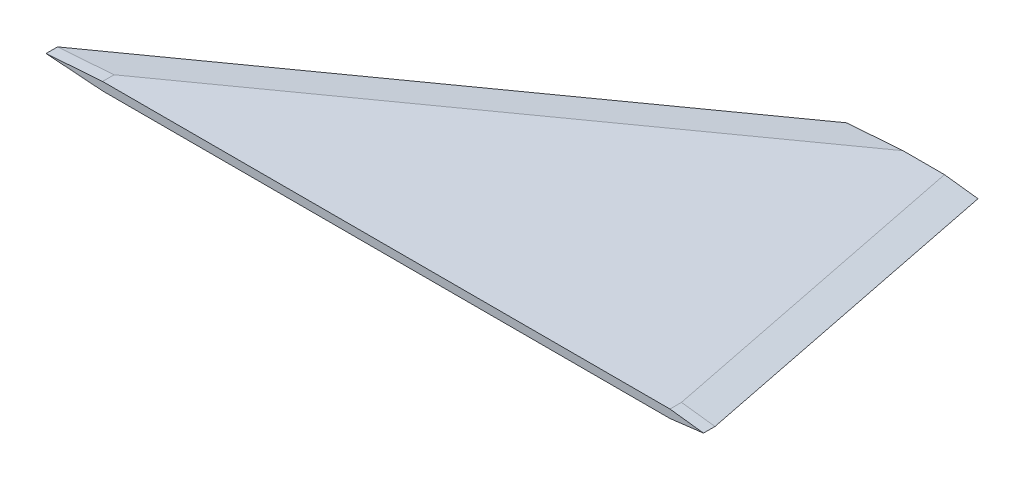
from build123d import *
from OCP.BRepFilletAPI import BRepFilletAPI_MakeChamfer

# Parameters (mm, degrees)
BOSS_EXTRUDE1_DEPTH = 1.5875
CHAMFER1_SIZE       = 1.5875
CHAMFER1_SIZE_2     = 12.7
CHAMFER2_SIZE       = 12.7
CHAMFER2_SIZE_2     = 1.5875
BOSS_EXTRUDE3_DEPTH = 4.445


# Some blends are built 0.0001 mm under size
with BuildPart() as part:
    # Sketch1 → Boss-Extrude1 (new, symmetric)
    with BuildSketch(Plane(origin=(0, 0, 0), x_dir=(1, 0, 0), z_dir=(0, 1, 0))):
        Polygon((-127, 0), (127, 0), (101.6, 127), (50.8, 127), align=None)
    extrude(amount=BOSS_EXTRUDE1_DEPTH, both=True)

    # Chamfer1
    # the kernel refuses this chamfer: 12.7, 1.5875 mm, written as the material it takes off along each edge
    with BuildSketch(Plane(origin=(77.661804698, 1.5875, -146.187003355), x_dir=(-0.1697730315694904, -0.9563912737708591, -0.2376822441972865), z_dir=(-0.8137334712067349, 0, 0.5812381937190965))) as chamfer1_piece_1:
        Polygon((CHAMFER1_SIZE * 0.956391273771, CHAMFER1_SIZE * 0.292088567827), (-CHAMFER1_SIZE_2 * 0.292088567827, CHAMFER1_SIZE_2 * 0.956391273771), (0, 0), align=None)
    extrude(amount=284.520199288, mode=Mode.SUBTRACT)
    with BuildSketch(Plane(origin=(77.661804698, -1.5875, -146.187003355), x_dir=(-0.1697730315694904, 0.9563912737708591, -0.2376822441972865), z_dir=(-0.8137334712067349, 0, 0.5812381937190965))) as chamfer1_piece_2:
        Polygon((CHAMFER1_SIZE * 0.956391273771, -CHAMFER1_SIZE * 0.292088567827), (-CHAMFER1_SIZE_2 * 0.292088567827, -CHAMFER1_SIZE_2 * 0.956391273771), (0, 0), align=None)
    extrude(amount=284.520199288, mode=Mode.SUBTRACT)

    # Chamfer2
    chamfer2_edges_1 = [part.edges().sort_by_distance(p)[0] for p in [
        (114.3, 1.5875, -63.5),
    ]]
    chamfer2_side_1 = [part.faces().sort_by_distance(p)[0] for p in [
        (114.268866564, 1.5875, -63.493773313),
    ]]
    chamfer2_edges_2 = [part.edges().sort_by_distance(p)[0] for p in [
        (114.3, -1.5875, -63.5),
    ]]
    chamfer2_side_2 = [part.faces().sort_by_distance(p)[0] for p in [
        (114.3, -1.55575, -63.5),
    ]]
    chamfer2 = BRepFilletAPI_MakeChamfer(part.part.solid().wrapped)
    for e in chamfer2_edges_1:
        chamfer2.Add(CHAMFER2_SIZE - 0.0001, CHAMFER2_SIZE_2 - 0.0001, e.wrapped, chamfer2_side_1[0].wrapped)
    for e in chamfer2_edges_2:
        chamfer2.Add(CHAMFER2_SIZE_2 - 0.0001, CHAMFER2_SIZE - 0.0001, e.wrapped, chamfer2_side_2[0].wrapped)
    add(Compound.cast(chamfer2.Shape()), mode=Mode.REPLACE)  # a hair under: the kernel refuses the full size

    # Sketch2 → Boss-Extrude3 (add)
    with BuildSketch(Plane.XY):
        Polygon((114.048490435, -1.5875), (127, 0), (114.048490435, 1.5875), (-105.150093822, 1.5875), (-127, 0), (-105.150093822, -1.5875), align=None)
    extrude(amount=BOSS_EXTRUDE3_DEPTH)


solid = part.part
